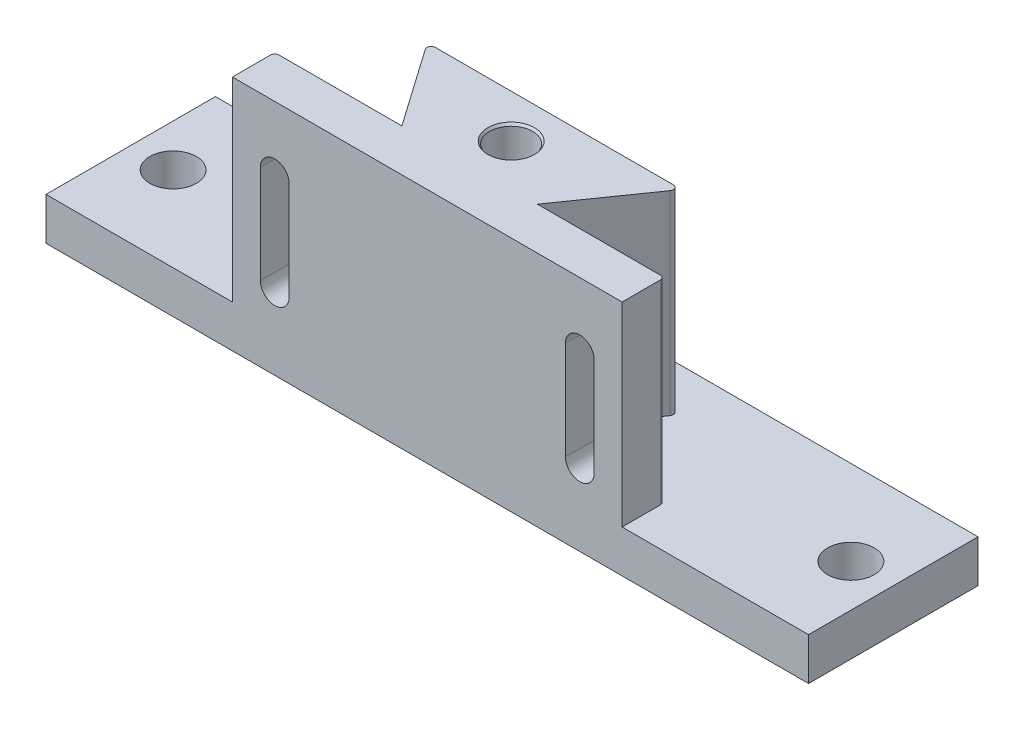
from build123d import *

# Parameters (mm, degrees)
SKETCH1_W                                       = 10
SKETCH1_H                                       = 20
BOSS_EXTRUDE1_DEPTH                             = 5
BOSS_EXTRUDE2_DEPTH                             = 28
M5_CLEARANCE_HOLE1_D                            = 5.5
M5_CLEARANCE_HOLE1_DEPTH                        = 10
M5_CLEARANCE_HOLE1_TIP                          = 1.652366702
CSK_FOR_M4_FLAT_HEAD_MACHINE_SCREW1_D           = 5.1
CSK_FOR_M4_FLAT_HEAD_MACHINE_SCREW1_DEPTH       = 15
CSK_FOR_M4_FLAT_HEAD_MACHINE_SCREW1_CSINK_D     = 5.5
CSK_FOR_M4_FLAT_HEAD_MACHINE_SCREW1_CSINK_ANGLE = 70
CSK_FOR_M4_FLAT_HEAD_MACHINE_SCREW1_TIP         = 1.532194579
FILLET1_R                                       = 0.5
M3_START                                        = -5
M3_CLEARANCE_SLOT1_DEPTH                        = 5


# Read off the part's stored shape, not the designer's step: M3 Clearance Slot1
with BuildPart() as part:
    # Sketch1 → Boss-Extrude1 (new body)
    with BuildSketch(Plane(origin=(0, 0, 0), x_dir=(1, 0, 0), z_dir=(0, 1, 0))):
        Polygon((0, 20), (0, 0), (12.002075382, 0), (12.002075382, 5), (27.002075382, 5), (20, 15), (50, 15), (42.997924618, 5), (57.997924618, 5), (57.997924618, 0), (70, 0), (70, 20), align=None)
        with Locations((-5, 10)):
            Rectangle(SKETCH1_W, SKETCH1_H)
        Polygon((12.002075382, 5), (12.002075382, 0), (57.997924618, 0), (57.997924618, 5), (42.997924618, 5), (50, 15), (20, 15), (27.002075382, 5), align=None)
        with Locations((75, 10)):
            Rectangle(SKETCH1_W, SKETCH1_H)
    extrude(amount=BOSS_EXTRUDE1_DEPTH)

    # Sketch1<3> → Boss-Extrude2 (add)
    with BuildSketch(Plane(origin=(0, 0, 0), x_dir=(1, 0, 0), z_dir=(0, 1, 0))):
        Polygon((12.002075382, 5), (12.002075382, 0), (57.997924618, 0), (57.997924618, 5), (42.997924618, 5), (50, 15), (20, 15), (27.002075382, 5), align=None)
    extrude(amount=BOSS_EXTRUDE2_DEPTH)

    # M5 Clearance Hole1
    with Locations(Plane(origin=(0, 5, 0), x_dir=(1, 0, 0), z_dir=(0, 1, 0))):
        with Locations((75, 10), (-5, 10)):
            Hole(M5_CLEARANCE_HOLE1_D / 2, depth=M5_CLEARANCE_HOLE1_DEPTH)
            with Locations((0, 0, -(M5_CLEARANCE_HOLE1_DEPTH + M5_CLEARANCE_HOLE1_TIP / 2))):  # 118° drill point
                Cone(0, M5_CLEARANCE_HOLE1_D / 2, M5_CLEARANCE_HOLE1_TIP, mode=Mode.SUBTRACT)

    # CSK for M4 Flat Head Machine Screw1
    with Locations(Plane(origin=(0, 28, 0), x_dir=(1, 0, 0), z_dir=(0, 1, 0))):
        with Locations((35, 9.9)):
            CounterSinkHole(CSK_FOR_M4_FLAT_HEAD_MACHINE_SCREW1_D / 2, CSK_FOR_M4_FLAT_HEAD_MACHINE_SCREW1_CSINK_D / 2, depth=CSK_FOR_M4_FLAT_HEAD_MACHINE_SCREW1_DEPTH, counter_sink_angle=CSK_FOR_M4_FLAT_HEAD_MACHINE_SCREW1_CSINK_ANGLE)
            with Locations((0, 0, -(CSK_FOR_M4_FLAT_HEAD_MACHINE_SCREW1_DEPTH + CSK_FOR_M4_FLAT_HEAD_MACHINE_SCREW1_TIP / 2))):  # 118° drill point
                Cone(0, CSK_FOR_M4_FLAT_HEAD_MACHINE_SCREW1_D / 2, CSK_FOR_M4_FLAT_HEAD_MACHINE_SCREW1_TIP, mode=Mode.SUBTRACT)

    # Fillet1
    fillet1_edges = [part.edges().sort_by_distance(p)[0] for p in [
        (12.002075382, 16.5, -5),
        (57.997924618, 16.5, -5),
        (50, 16.5, -15),
        (20, 16.5, -15),
    ]]
    fillet(fillet1_edges, radius=FILLET1_R)

    # M3 Clearance Slot1 outline → M3 Clearance Slot1 (cut)
    with BuildSketch(Plane.XY.offset(M3_START)):
        with BuildLine():
            Line((54.697924618, 8.835678671), (54.697924618, 20.435678671))
            ThreePointArc((54.697924618, 20.435678671), (52.997924618, 22.135678671), (51.297924618, 20.435678671))
            Line((51.297924618, 20.435678671), (51.297924618, 8.835678671))
            ThreePointArc((51.297924618, 8.835678671), (52.997924618, 7.135678671), (54.697924618, 8.835678671))
        make_face()
        with BuildLine():
            Line((18.702075382, 8.835678671), (18.702075382, 20.435678671))
            ThreePointArc((18.702075382, 20.435678671), (17.002075382, 22.135678671), (15.302075382, 20.435678671))
            Line((15.302075382, 20.435678671), (15.302075382, 8.835678671))
            ThreePointArc((15.302075382, 8.835678671), (17.002075382, 7.135678671), (18.702075382, 8.835678671))
        make_face()
    extrude(amount=M3_CLEARANCE_SLOT1_DEPTH, mode=Mode.SUBTRACT)


solid = part.part
